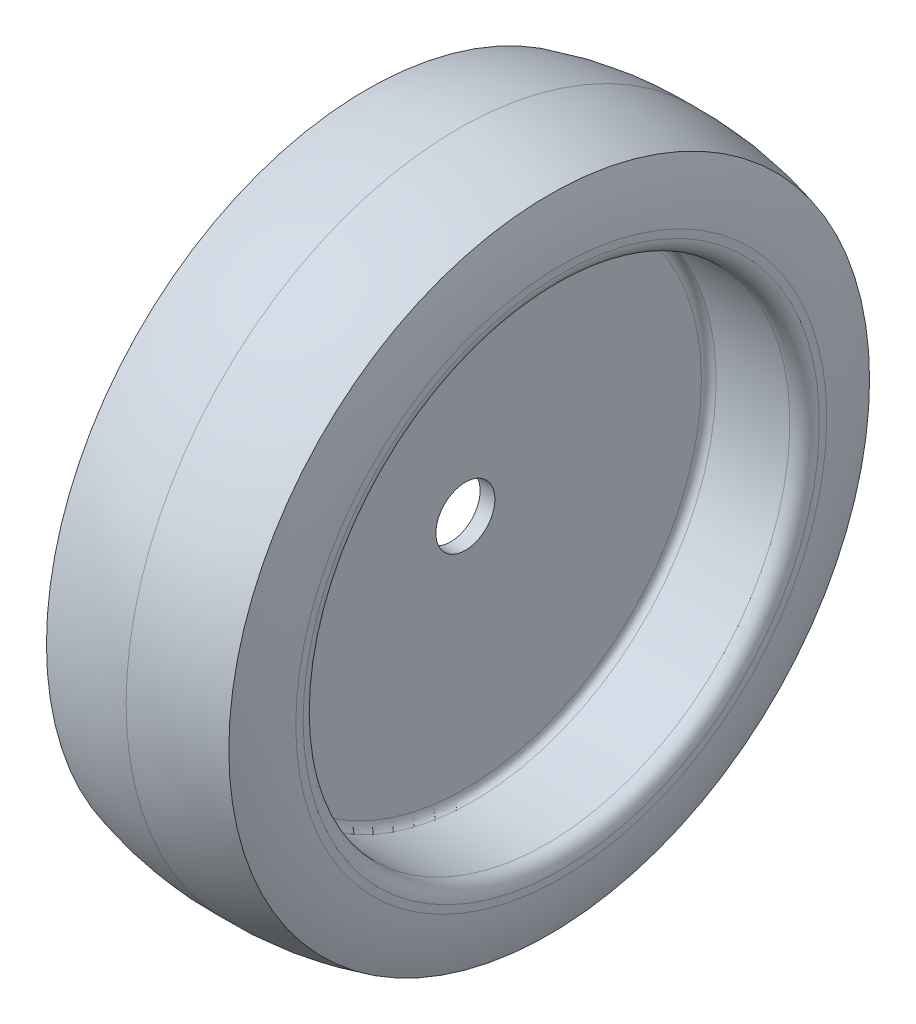
from build123d import *


# Read off the part's stored shape, not the designer's step: Revolve-Thin1
with BuildPart() as part:
    # Revolve-Thin1 outline → Revolve-Thin1 (revolve)
    with BuildSketch(Plane.YX):
        with BuildLine():
            Line((4, 1), (4, 0))
            Line((4, 0), (32, 0))
            ThreePointArc((32, 0), (33.414213562, 0.585786438), (34, 2))
            Line((34, 2), (34, 12))
            ThreePointArc((34, 12), (34.292893219, 12.707106781), (35, 13))
            ThreePointArc((35, 13), (35.707106781, 13.292893219), (36, 14))
            Line((36, 14), (35, 14))
            ThreePointArc((35, 14), (33.585786438, 13.414213562), (33, 12))
            Line((33, 12), (33, 2))
            ThreePointArc((33, 2), (32.707106781, 1.292893219), (32, 1))
            Line((32, 1), (4, 1))
        make_face()
    revolve(axis=Axis((0, 0, 0), (1, 0, 0)))

    # Mirror3: part across plane


with BuildPart() as body_2:
    # Sketch6 → Revolve2 (revolve)
    with BuildSketch(Plane.XY, mode=Mode.PRIVATE) as revolve2_sk:
        with BuildLine():
            Line((0, 32), (0, 45))
            ThreePointArc((0, 45), (6.24102473, 44.687783986), (12.363638048, 43.438194182))
            ThreePointArc((12.363638048, 43.438194182), (13.460804447, 39.780472355), (14, 36))
            ThreePointArc((14, 36), (13.292893219, 35.707106781), (13, 35))
            ThreePointArc((13, 35), (12.707106781, 34.292893219), (12, 34))
            Line((12, 34), (2, 34))
            ThreePointArc((2, 34), (0.585786438, 33.414213562), (0, 32))
        make_face()
    revolve(revolve2_sk.sketch.rotate(Axis((0, 0, 0), (1, 0, 0)), 90), axis=Axis((0, 0, 0), (1, 0, 0)))

    # Mirror3 2: body 2 across plane


with BuildPart() as part_1:
    add(part.part)
    add(part.part.mirror(Plane(origin=(0, 0, 0), x_dir=(0, 0, 1), z_dir=(1, 0, 0))))


with BuildPart() as body_2_1:
    add(body_2.part)
    add(body_2.part.mirror(Plane(origin=(0, 0, 0), x_dir=(0, 0, 1), z_dir=(1, 0, 0))))


solid = Compound([part_1.part, body_2_1.part])
